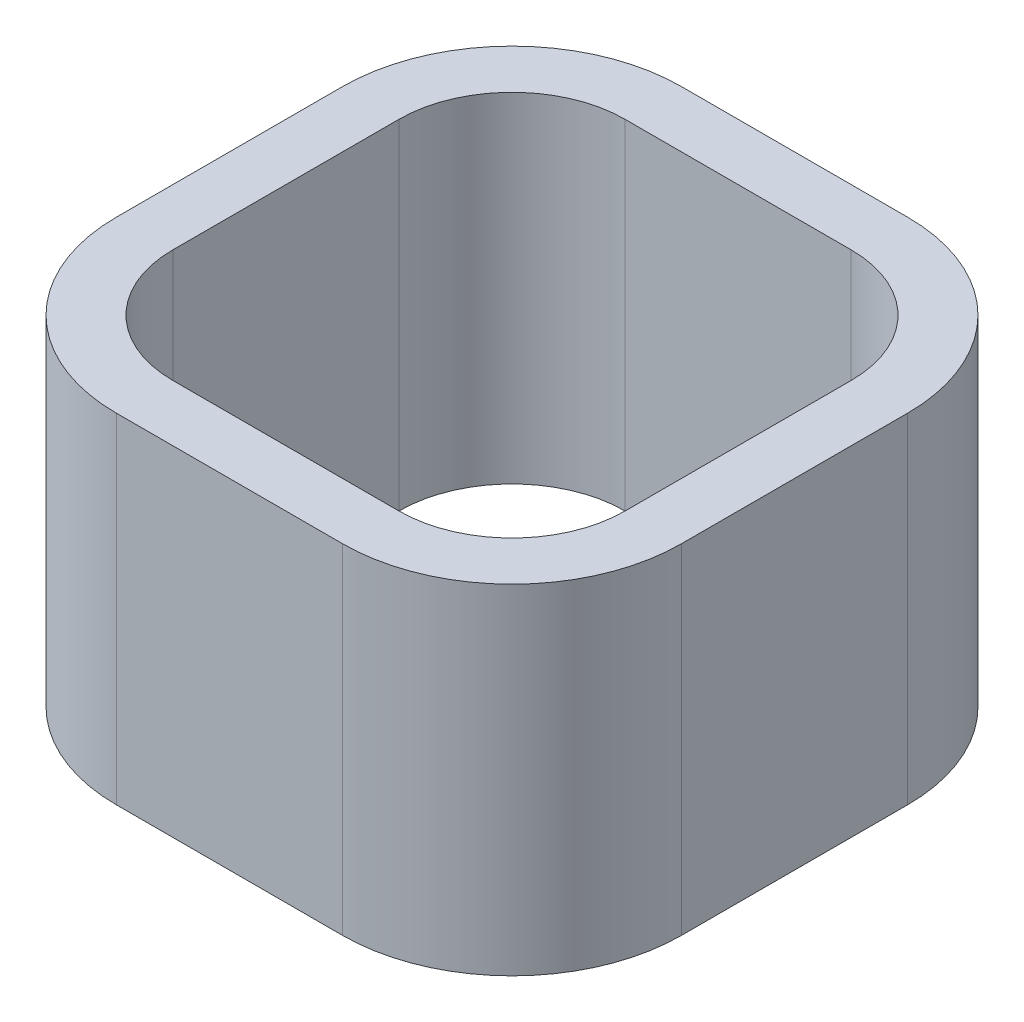
from build123d import *

# Parameters (mm, degrees)
SKIZZE1_W                            = 5
SKIZZE1_H                            = 5
SKIZZE1_W_2                          = 4
SKIZZE1_H_2                          = 4
AUFSATZ_LINEAR_AUSTRAGEN1_DEPTH      = 3
VERRUNDUNG1_R                        = 1
VERRUNDUNG2_R                        = 1.5
F_0_3_0_3_DURCHMESSER_BOHRUNG3_D     = 0.3
F_0_3_0_3_DURCHMESSER_BOHRUNG3_DEPTH = 0.01
F_0_3_0_3_DURCHMESSER_BOHRUNG3_TIP   = 0.15


with BuildPart() as part:
    # Skizze1 → Aufsatz-Linear austragen1 (new body)
    with BuildSketch(Plane(origin=(0, 0, 0), x_dir=(1, 0, 0), z_dir=(0, 1, 0))):
        Rectangle(SKIZZE1_W, SKIZZE1_H)
        Rectangle(SKIZZE1_W_2, SKIZZE1_H_2, mode=Mode.SUBTRACT)
    extrude(amount=AUFSATZ_LINEAR_AUSTRAGEN1_DEPTH)

    # Verrundung1
    verrundung1_edges = [part.edges().sort_by_distance(p)[0] for p in [
        (-2, 1.5, 2),
        (2, 1.5, 2),
        (2, 1.5, -2),
        (-2, 1.5, -2),
    ]]
    fillet(verrundung1_edges, radius=VERRUNDUNG1_R)

    # Verrundung2
    verrundung2_edges = [part.edges().sort_by_distance(p)[0] for p in [
        (2.5, 1.5, 2.5),
        (-2.5, 1.5, 2.5),
        (-2.5, 1.5, -2.5),
        (2.5, 1.5, -2.5),
    ]]
    fillet(verrundung2_edges, radius=VERRUNDUNG2_R)

    # Ø0.3 (0.3) Durchmesser Bohrung3
    with Locations(Plane(origin=(-2.060660172, 0, -2.060660172), x_dir=(-0.7071067811865437, 0, 0.7071067811865515), z_dir=(-0.7071067811865515, 0, -0.7071067811865437))):
        with Locations((0, 1.5)):
            Hole(F_0_3_0_3_DURCHMESSER_BOHRUNG3_D / 2, depth=F_0_3_0_3_DURCHMESSER_BOHRUNG3_DEPTH)
            with Locations((0, 0, -(F_0_3_0_3_DURCHMESSER_BOHRUNG3_DEPTH + F_0_3_0_3_DURCHMESSER_BOHRUNG3_TIP / 2))):  # 90° drill point
                Cone(0, F_0_3_0_3_DURCHMESSER_BOHRUNG3_D / 2, F_0_3_0_3_DURCHMESSER_BOHRUNG3_TIP, mode=Mode.SUBTRACT)


solid = part.part
